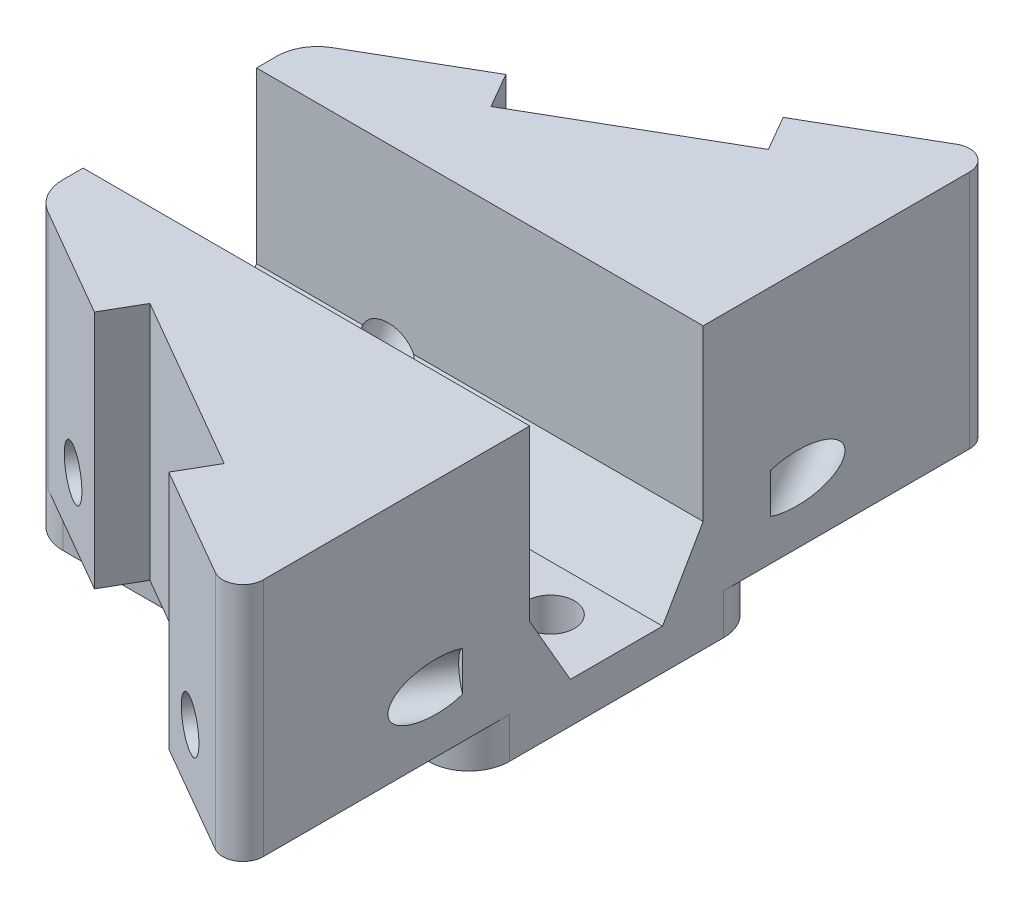
from build123d import *

# Parameters (mm, degrees)
SKETCH1_R                  = 1.5
BOSS_EXTRUDE1_DEPTH        = 2.54
BOSS_EXTRUDE3_DEPTH        = 15
SKETCH5_R                  = 1.5
CUT_EXTRUDE1_DEPTH         = 12.7
CHAMFER1_SIZE              = 2.54
CHAMFER1_SIZE_2            = 4.399409051
CUT_EXTRUDE5_DEPTH         = 36.401142437
CHAMFER1_OF_MIRROR1_SIZE   = 4.399409051
CHAMFER1_OF_MIRROR1_SIZE_2 = 2.54


with BuildPart() as part:
    # Sketch1 → Boss-Extrude1 (new body)
    with BuildSketch(Plane(origin=(0, 0, 0), x_dir=(1, 0, 0), z_dir=(0, 1, 0))):
        with BuildLine():
            Line((-2.46, 6.35), (20.4, 6.35))
            ThreePointArc((20.4, 6.35), (22.196051224, 5.606051224), (22.94, 3.81))
            Line((22.94, 3.81), (22.94, -3.81))
            ThreePointArc((22.94, -3.81), (22.196051224, -5.606051224), (20.4, -6.35))
            Line((20.4, -6.35), (-2.46, -6.35))
            ThreePointArc((-2.46, -6.35), (-4.256051224, -5.606051224), (-5, -3.81))
            Line((-5, -3.81), (-5, 3.81))
            ThreePointArc((-5, 3.81), (-4.256051224, 5.606051224), (-2.46, 6.35))
        make_face()
        with Locations(Location((-1.19, -2.88414655, 0), (0, 0, 270))):
            Circle(SKETCH1_R, mode=Mode.SUBTRACT)
        with Locations(Location((8.81, -2.88414655, 0), (0, 0, 270))):
            Circle(SKETCH1_R, mode=Mode.SUBTRACT)
        with Locations(Location((18.81, -2.88414655, 0), (0, 0, 270))):
            Circle(SKETCH1_R, mode=Mode.SUBTRACT)
    boss_extrude1 = extrude(amount=BOSS_EXTRUDE1_DEPTH)

    # Sketch3 → Boss-Extrude3 (add)
    with BuildSketch(Plane(origin=(0, 2.54, 0), x_dir=(1, 0, 0), z_dir=(0, 1, 0))):
        with BuildLine():
            Line((-5, 2.54), (22.94, 2.54))
            Line((22.94, 2.54), (22.94, 3.81))
            Line((22.94, 3.81), (22.94, 19.207931679))
            ThreePointArc((22.94, 19.207931679), (22.305, 20.307783942), (21.035, 20.307783942))
            Line((21.035, 20.307783942), (-3.73, 6.009704526))
            ThreePointArc((-3.73, 6.009704526), (-4.659704526, 5.08), (-5, 3.81))
            Line((-5, 3.81), (-5, 2.54))
        make_face()
    boss_extrude3 = extrude(amount=BOSS_EXTRUDE3_DEPTH)

    # Sketch5 → Cut-Extrude1 (cut)
    with BuildSketch(Plane(origin=(-5.860422493, 0, -4.779704526), x_dir=(0.8660254037844379, 0, -0.5000000000000014), z_dir=(0.5000000000000013, 0, 0.8660254037844378))):
        with Locations(Location((6.758079416, 6.35, 0), (0, 0, 180))):
            Circle(SKETCH5_R)
        with Locations(Location((26.758079416, 6.35, 0), (0, 0, 180))):
            Circle(SKETCH5_R)
    cut_extrude1 = extrude(amount=CUT_EXTRUDE1_DEPTH, mode=Mode.SUBTRACT)

    # Chamfer1
    # the kernel refuses this chamfer: 4.399409051, 2.54 mm, written as the material it adds along each edge
    with BuildSketch(Plane(origin=(-5, 2.54, -2.54), x_dir=(0, -0.057893862402671366, 0.9983227437537925), z_dir=(1, 0, 0))) as chamfer1_piece_1_section:
        Polygon((CHAMFER1_SIZE * 0.998322743754, -CHAMFER1_SIZE * 0.0578938624027), (-CHAMFER1_SIZE_2 * 0.0578938624056, -CHAMFER1_SIZE_2 * 0.998322743805), (0, 0), align=None)
    chamfer1_piece_1 = extrude(amount=27.94, mode=Mode.PRIVATE)
    chamfer1_piece_1 = chamfer1_piece_1 - Plane(origin=(5.060500306, 6.35, 0.619729795), x_dir=(-0.8660254037844379, 0, 0.5000000000000014), z_dir=(-0.5000000000000014, 0, -0.8660254037844379)) * Cylinder(1.5, 74, mode=Mode.PRIVATE)
    add(chamfer1_piece_1)

    # Sketch11 → Cut-Extrude5 (cut, symmetric)
    with BuildSketch(Plane(origin=(0, 17.54, 0), x_dir=(1, 0, 0), z_dir=(0, 1, 0))):
        Polygon((3.153238686, 9.983744234), (4.423238686, 7.784039708), (15.421761314, 14.134039708), (14.151761314, 16.333744234), align=None)
    cut_extrude5 = extrude(amount=CUT_EXTRUDE5_DEPTH, both=True, mode=Mode.SUBTRACT)

    # Mirror1: Boss-Extrude1, Boss-Extrude3, Cut-Extrude1, Cut-Extrude5 across plane
    add(boss_extrude1.mirror(Plane.XY.offset(2.88414655)))
    add(boss_extrude3.mirror(Plane.XY.offset(2.88414655)))
    add(cut_extrude1.mirror(Plane.XY.offset(2.88414655)), mode=Mode.SUBTRACT)
    add(cut_extrude5.mirror(Plane.XY.offset(2.88414655)), mode=Mode.SUBTRACT)

    # Chamfer1 of Mirror1
    # the kernel refuses this chamfer: 4.399409051, 2.54 mm, written as the material it adds along each edge
    with BuildSketch(Plane(origin=(-5, 2.54, 8.308293101), x_dir=(0, 0.9998132206222079, 0.019326765612700737), z_dir=(1, 0, 0))) as chamfer1_of_mirror1_piece_1_section:
        Polygon((CHAMFER1_OF_MIRROR1_SIZE * 0.999813220673, -CHAMFER1_OF_MIRROR1_SIZE * 0.0193267656137), (-CHAMFER1_OF_MIRROR1_SIZE_2 * 0.0193267656127, -CHAMFER1_OF_MIRROR1_SIZE_2 * 0.999813220622), (0, 0), align=None)
    chamfer1_of_mirror1_piece_1 = extrude(amount=27.94, mode=Mode.PRIVATE)
    chamfer1_of_mirror1_piece_1 = chamfer1_of_mirror1_piece_1 - Plane(origin=(5.060500238, 6.35, 5.148563423), x_dir=(-0.8660254037844379, 0, -0.5000000000000014), z_dir=(-0.5000000000000014, 0, 0.8660254037844379)) * Cylinder(1.5, 74, mode=Mode.PRIVATE)
    add(chamfer1_of_mirror1_piece_1)


solid = part.part
